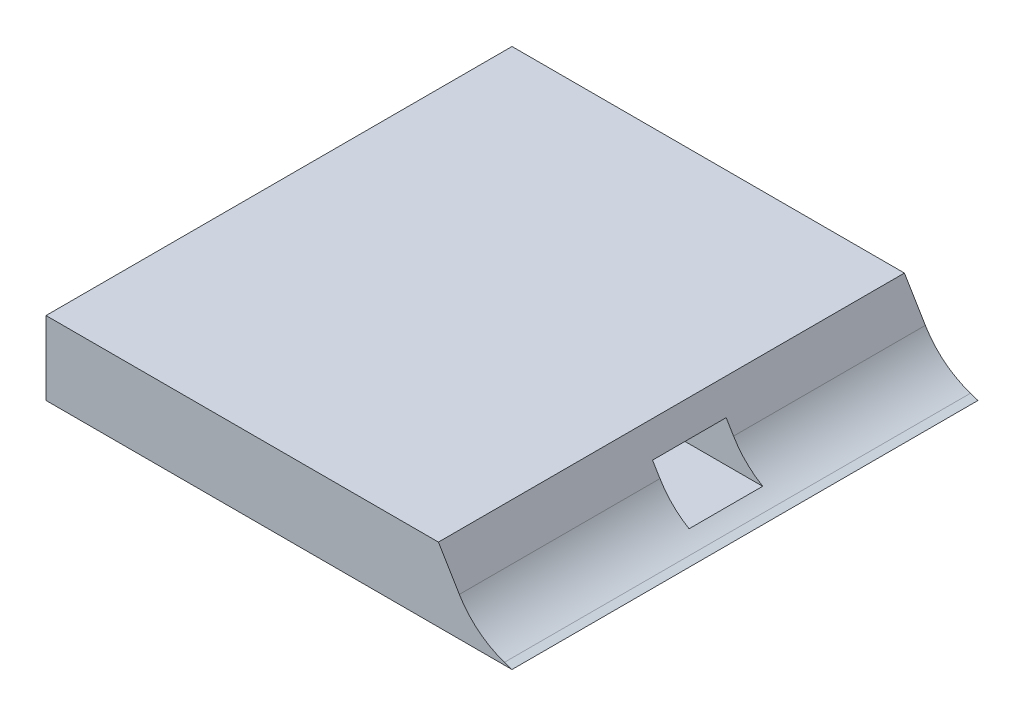
from build123d import *

# Parameters (mm, degrees)
SKETCH1_W           = 90
SKETCH1_H           = 95
BOSS_EXTRUDE3_DEPTH = 15
SKETCH5_W           = 15
SKETCH5_H           = 8.4
CUT_EXTRUDE3_DEPTH  = 40
SKETCH7_W           = 95
SKETCH7_H           = 15
BOSS_EXTRUDE4_DEPTH = 5
CUT_EXTRUDE4_DEPTH  = 100
FILLET6_R           = 17


with BuildPart() as part:
    # Sketch1 → Boss-Extrude3 (new body)
    with BuildSketch(Plane(origin=(0, 0, 0), x_dir=(1, 0, 0), z_dir=(0, 1, 0))):
        Rectangle(SKETCH1_W, SKETCH1_H)
    extrude(amount=BOSS_EXTRUDE3_DEPTH)

    # Sketch5 → Cut-Extrude3 (cut)
    with BuildSketch(Plane(origin=(45, 0, 0), x_dir=(0, 0, -1), z_dir=(1, 0, 0))):
        with Locations((0.9, 6.2)):
            Rectangle(SKETCH5_W, SKETCH5_H)
    extrude(amount=-CUT_EXTRUDE3_DEPTH, mode=Mode.SUBTRACT)

    # Sketch7 → Boss-Extrude4 (add)
    with BuildSketch(Plane(origin=(45, 0, 0), x_dir=(0, 0, -1), z_dir=(1, 0, 0))):
        with Locations((0, 7.5)):
            Rectangle(SKETCH7_W, SKETCH7_H)
    extrude(amount=BOSS_EXTRUDE4_DEPTH)

    # Sketch8 → Cut-Extrude4 (cut)
    with BuildSketch(Plane.XY.offset(47.5)):
        Polygon((42.5, 2.5), (50, 0), (50, 15), (35, 15), align=None)
    extrude(amount=-CUT_EXTRUDE4_DEPTH, mode=Mode.SUBTRACT)

    # Fillet6
    # the kernel refuses this fillet: 17 mm, written as the material it adds along each edge
    with BuildSketch(Plane(origin=(42.5, 2.5, 7.321773239), x_dir=(0.9486832980505139, -0.316227766016838, 0), z_dir=(0, 0, -1))) as fillet6_piece_1_section:
        with BuildLine():
            CenterArc((FILLET6_R * 0.369924076215, -FILLET6_R), FILLET6_R, 90, 40.601294645)
            Line((-FILLET6_R * 0.28086729724, -FILLET6_R * 0.240743397635), (0, 0))
            Line((0, 0), (FILLET6_R * 0.369924076215, 0))
        make_face()
    fillet6_piece_1 = extrude(amount=54.821773239, mode=Mode.PRIVATE)
    fillet6_piece_1 = split(fillet6_piece_1, bisect_by=Plane(origin=(45.830299546, 2, 6.96088662), z_dir=(0, -1, 0)), keep=Keep.TOP, mode=Mode.PRIVATE)
    fillet6_piece_1 = split(fillet6_piece_1, bisect_by=Plane(origin=(45.830299546, 1.289116615, 6.6), z_dir=(0, 0, 1)), keep=Keep.TOP, mode=Mode.PRIVATE)
    add(fillet6_piece_1)
    with BuildSketch(Plane(origin=(42.5, 2.5, 7.321773239), x_dir=(0.9486832980505139, -0.316227766016838, 0), z_dir=(0, 0, -1))) as fillet6_piece_2_section:
        with BuildLine():
            CenterArc((FILLET6_R * 0.369924076215, -FILLET6_R), FILLET6_R, 90, 40.601294645)
            Line((-FILLET6_R * 0.28086729724, -FILLET6_R * 0.240743397635), (0, 0))
            Line((0, 0), (FILLET6_R * 0.369924076215, 0))
        make_face()
    fillet6_piece_2 = extrude(amount=54.821773239, mode=Mode.PRIVATE)
    fillet6_piece_2 = split(fillet6_piece_2, bisect_by=Plane(origin=(42.01228151, 2, 6.96088662), z_dir=(0, 1, 0)), keep=Keep.TOP, mode=Mode.PRIVATE)
    fillet6_piece_2 = split(fillet6_piece_2, bisect_by=Plane(origin=(42.01228151, 3.937960854, 6.6), z_dir=(0, 0, 1)), keep=Keep.TOP, mode=Mode.PRIVATE)
    add(fillet6_piece_2)
    with BuildSketch(Plane(origin=(42.5, 2.5, 7.321773239), x_dir=(0.9486832980505139, -0.316227766016838, 0), z_dir=(0, 0, -1))) as fillet6_piece_3_section:
        with BuildLine():
            CenterArc((FILLET6_R * 0.369924076215, -FILLET6_R), FILLET6_R, 90, 40.601294645)
            Line((-FILLET6_R * 0.28086729724, -FILLET6_R * 0.240743397635), (0, 0))
            Line((0, 0), (FILLET6_R * 0.369924076215, 0))
        make_face()
    fillet6_piece_3 = extrude(amount=54.821773239, mode=Mode.PRIVATE)
    fillet6_piece_3 = split(fillet6_piece_3, bisect_by=Plane(origin=(45.830299546, 1.289116615, -8.4), z_dir=(0, 0, 1)), keep=Keep.TOP, mode=Mode.PRIVATE)
    fillet6_piece_3 = split(fillet6_piece_3, bisect_by=Plane(origin=(45.830299546, 2, -0.9), z_dir=(0, -1, 0)), keep=Keep.TOP, mode=Mode.PRIVATE)
    fillet6_piece_3 = split(fillet6_piece_3, bisect_by=Plane(origin=(45.830299546, 1.289116615, 6.6), z_dir=(0, 0, -1)), keep=Keep.TOP, mode=Mode.PRIVATE)
    add(fillet6_piece_3)
    with BuildSketch(Plane(origin=(42.5, 2.5, -8.4), x_dir=(0.9486832980505139, -0.316227766016838, 0), z_dir=(0, 0, -1))) as fillet6_piece_4_section:
        with BuildLine():
            CenterArc((FILLET6_R * 0.369924076215, -FILLET6_R), FILLET6_R, 90, 40.601294645)
            Line((-FILLET6_R * 0.28086729724, -FILLET6_R * 0.240743397635), (0, 0))
            Line((0, 0), (FILLET6_R * 0.369924076215, 0))
        make_face()
    fillet6_piece_4 = extrude(amount=39.1, mode=Mode.PRIVATE)
    fillet6_piece_4 = split(fillet6_piece_4, bisect_by=Plane(origin=(45.830299546, 2, -27.95), z_dir=(0, -1, 0)), keep=Keep.TOP, mode=Mode.PRIVATE)
    add(fillet6_piece_4)
    with BuildSketch(Plane(origin=(42.5, 2.5, -8.4), x_dir=(0.9486832980505139, -0.316227766016838, 0), z_dir=(0, 0, -1))) as fillet6_piece_5_section:
        with BuildLine():
            CenterArc((FILLET6_R * 0.369924076215, -FILLET6_R), FILLET6_R, 90, 40.601294645)
            Line((-FILLET6_R * 0.28086729724, -FILLET6_R * 0.240743397635), (0, 0))
            Line((0, 0), (FILLET6_R * 0.369924076215, 0))
        make_face()
    fillet6_piece_5 = extrude(amount=39.1, mode=Mode.PRIVATE)
    fillet6_piece_5 = split(fillet6_piece_5, bisect_by=Plane(origin=(42.01228151, 2, -27.95), z_dir=(0, 1, 0)), keep=Keep.TOP, mode=Mode.PRIVATE)
    add(fillet6_piece_5)
    with BuildSketch(Plane(origin=(42.5, 2.5, 47.5), x_dir=(0.9486832980505139, -0.316227766016838, 0), z_dir=(0, 0, -1))) as fillet6_piece_6_section:
        with BuildLine():
            CenterArc((FILLET6_R * 0.369924076215, -FILLET6_R), FILLET6_R, 90, 40.601294645)
            Line((-FILLET6_R * 0.28086729724, -FILLET6_R * 0.240743397635), (0, 0))
            Line((0, 0), (FILLET6_R * 0.369924076215, 0))
        make_face()
    fillet6_piece_6 = extrude(amount=40.9, mode=Mode.PRIVATE)
    fillet6_piece_6 = split(fillet6_piece_6, bisect_by=Plane(origin=(45.830299546, 2, 27.05), z_dir=(0, -1, 0)), keep=Keep.TOP, mode=Mode.PRIVATE)
    add(fillet6_piece_6)
    with BuildSketch(Plane(origin=(42.5, 2.5, 47.5), x_dir=(0.9486832980505139, -0.316227766016838, 0), z_dir=(0, 0, -1))) as fillet6_piece_7_section:
        with BuildLine():
            CenterArc((FILLET6_R * 0.369924076215, -FILLET6_R), FILLET6_R, 90, 40.601294645)
            Line((-FILLET6_R * 0.28086729724, -FILLET6_R * 0.240743397635), (0, 0))
            Line((0, 0), (FILLET6_R * 0.369924076215, 0))
        make_face()
    fillet6_piece_7 = extrude(amount=40.9, mode=Mode.PRIVATE)
    fillet6_piece_7 = split(fillet6_piece_7, bisect_by=Plane(origin=(42.01228151, 2, 27.05), z_dir=(0, 1, 0)), keep=Keep.TOP, mode=Mode.PRIVATE)
    add(fillet6_piece_7)
    with BuildSketch(Plane(origin=(42.5, 2.5, 47.5), x_dir=(0.9486832980505139, -0.316227766016838, 0), z_dir=(0, 0, -1))) as fillet6_piece_8_section:
        with BuildLine():
            CenterArc((FILLET6_R * 0.369924076215, -FILLET6_R), FILLET6_R, 90, 40.601294645)
            Line((-FILLET6_R * 0.28086729724, -FILLET6_R * 0.240743397635), (0, 0))
            Line((0, 0), (FILLET6_R * 0.369924076215, 0))
        make_face()
    fillet6_piece_8 = extrude(amount=56.621773239, mode=Mode.PRIVATE)
    fillet6_piece_8 = split(fillet6_piece_8, bisect_by=Plane(origin=(45.830299546, 1.289116615, -8.4), z_dir=(0, 0, 1)), keep=Keep.TOP, mode=Mode.PRIVATE)
    fillet6_piece_8 = split(fillet6_piece_8, bisect_by=Plane(origin=(45.830299546, 2, -0.9), z_dir=(0, -1, 0)), keep=Keep.TOP, mode=Mode.PRIVATE)
    fillet6_piece_8 = split(fillet6_piece_8, bisect_by=Plane(origin=(45.830299546, 1.289116615, 6.6), z_dir=(0, 0, -1)), keep=Keep.TOP, mode=Mode.PRIVATE)
    add(fillet6_piece_8)
    with BuildSketch(Plane(origin=(42.5, 2.5, 47.5), x_dir=(0.9486832980505139, -0.316227766016838, 0), z_dir=(0, 0, -1))) as fillet6_piece_9_section:
        with BuildLine():
            CenterArc((FILLET6_R * 0.369924076215, -FILLET6_R), FILLET6_R, 90, 40.601294645)
            Line((-FILLET6_R * 0.28086729724, -FILLET6_R * 0.240743397635), (0, 0))
            Line((0, 0), (FILLET6_R * 0.369924076215, 0))
        make_face()
    fillet6_piece_9 = extrude(amount=56.621773239, mode=Mode.PRIVATE)
    fillet6_piece_9 = split(fillet6_piece_9, bisect_by=Plane(origin=(45.830299546, 1.289116615, -8.4), z_dir=(0, 0, -1)), keep=Keep.TOP, mode=Mode.PRIVATE)
    fillet6_piece_9 = split(fillet6_piece_9, bisect_by=Plane(origin=(45.830299546, 2, -8.76088662), z_dir=(0, -1, 0)), keep=Keep.TOP, mode=Mode.PRIVATE)
    add(fillet6_piece_9)
    with BuildSketch(Plane(origin=(42.5, 2.5, 47.5), x_dir=(0.9486832980505139, -0.316227766016838, 0), z_dir=(0, 0, -1))) as fillet6_piece_10_section:
        with BuildLine():
            CenterArc((FILLET6_R * 0.369924076215, -FILLET6_R), FILLET6_R, 90, 40.601294645)
            Line((-FILLET6_R * 0.28086729724, -FILLET6_R * 0.240743397635), (0, 0))
            Line((0, 0), (FILLET6_R * 0.369924076215, 0))
        make_face()
    fillet6_piece_10 = extrude(amount=56.621773239, mode=Mode.PRIVATE)
    fillet6_piece_10 = split(fillet6_piece_10, bisect_by=Plane(origin=(42.01228151, 3.937960854, -8.4), z_dir=(0, 0, -1)), keep=Keep.TOP, mode=Mode.PRIVATE)
    fillet6_piece_10 = split(fillet6_piece_10, bisect_by=Plane(origin=(42.01228151, 2, -8.76088662), z_dir=(0, 1, 0)), keep=Keep.TOP, mode=Mode.PRIVATE)
    add(fillet6_piece_10)


solid = part.part
